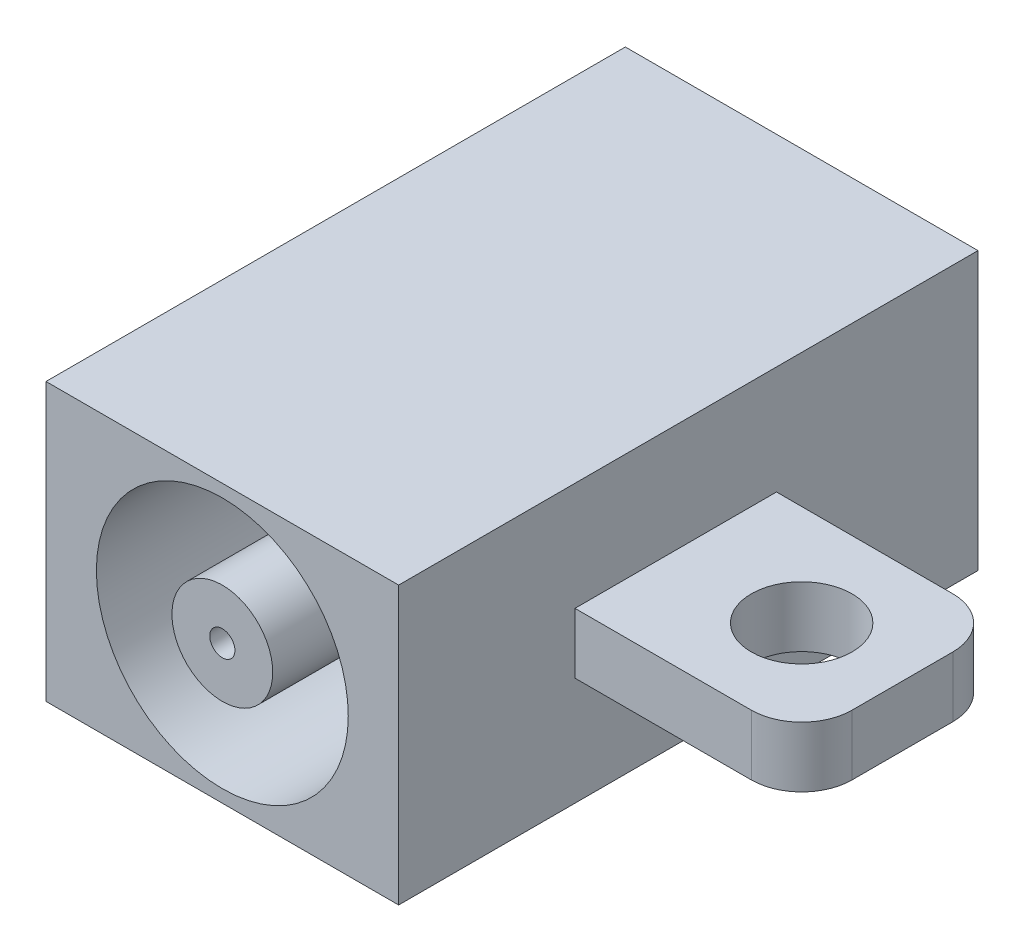
from build123d import *

# Parameters (mm, degrees)
SKETCH1_W           = 7
SKETCH1_H           = 11.5
BOSS_EXTRUDE1_DEPTH = 5.5
SKETCH2_R           = 2.5
CUT_EXTRUDE1_DEPTH  = 5.5
SKETCH3_R           = 1
BOSS_EXTRUDE2_DEPTH = 5.5
SKETCH4_R           = 0.25
CUT_EXTRUDE2_DEPTH  = 5.5
SKETCH5_W           = 4
SKETCH5_H           = 1.2
BOSS_EXTRUDE3_DEPTH = 4.5
FILLET1_R           = 1
CUT_EXTRUDE3_REACH  = 18.605
SKETCH6_R           = 1


with BuildPart() as part:
    # Sketch1 → Boss-Extrude1 (new body)
    with BuildSketch(Plane(origin=(0, 0, 0), x_dir=(1, 0, 0), z_dir=(0, 1, 0))):
        with Locations((3.5, 5.75)):
            Rectangle(SKETCH1_W, SKETCH1_H)
    extrude(amount=BOSS_EXTRUDE1_DEPTH)

    # Sketch2 → Cut-Extrude1 (cut)
    with BuildSketch(Plane.XY):
        with Locations((3.5, 2.75)):
            Circle(SKETCH2_R)
    extrude(amount=-CUT_EXTRUDE1_DEPTH, mode=Mode.SUBTRACT)

    # Sketch3 → Boss-Extrude2 (add)
    with BuildSketch(Plane.XY):
        with Locations((3.5, 2.75)):
            Circle(SKETCH3_R)
    extrude(amount=-BOSS_EXTRUDE2_DEPTH)

    # Sketch4 → Cut-Extrude2 (cut)
    with BuildSketch(Plane.XY):
        with Locations((3.5, 2.75)):
            Circle(SKETCH4_R)
    extrude(amount=-CUT_EXTRUDE2_DEPTH, mode=Mode.SUBTRACT)

    # Sketch5 → Boss-Extrude3 (add)
    with BuildSketch(Plane(origin=(7, 0, 0), x_dir=(0, 0, -1), z_dir=(1, 0, 0))):
        with Locations((5.5, 2.75)):
            Rectangle(SKETCH5_W, SKETCH5_H)
    extrude(amount=BOSS_EXTRUDE3_DEPTH)

    # Fillet1
    fillet1_edges = [part.edges().sort_by_distance(p)[0] for p in [
        (11.5, 2.75, -7.5),
        (11.5, 2.75, -3.5),
    ]]
    fillet(fillet1_edges, radius=FILLET1_R)

    # Sketch6 → Cut-Extrude3 (cut, up to next)
    with BuildSketch(Plane(origin=(0, 3.35, 0), x_dir=(1, 0, 0), z_dir=(0, 1, 0)), mode=Mode.PRIVATE) as cut_extrude3_sk1:
        with Locations((9.5, 5.5)):
            Circle(SKETCH6_R)
    cut_extrude3_tool1 = extrude(cut_extrude3_sk1.sketch, amount=-CUT_EXTRUDE3_REACH, mode=Mode.PRIVATE) & part.part
    add(cut_extrude3_tool1.solids().sort_by_distance((9.5, 3.35, -5.5))[0], mode=Mode.SUBTRACT)


solid = part.part
